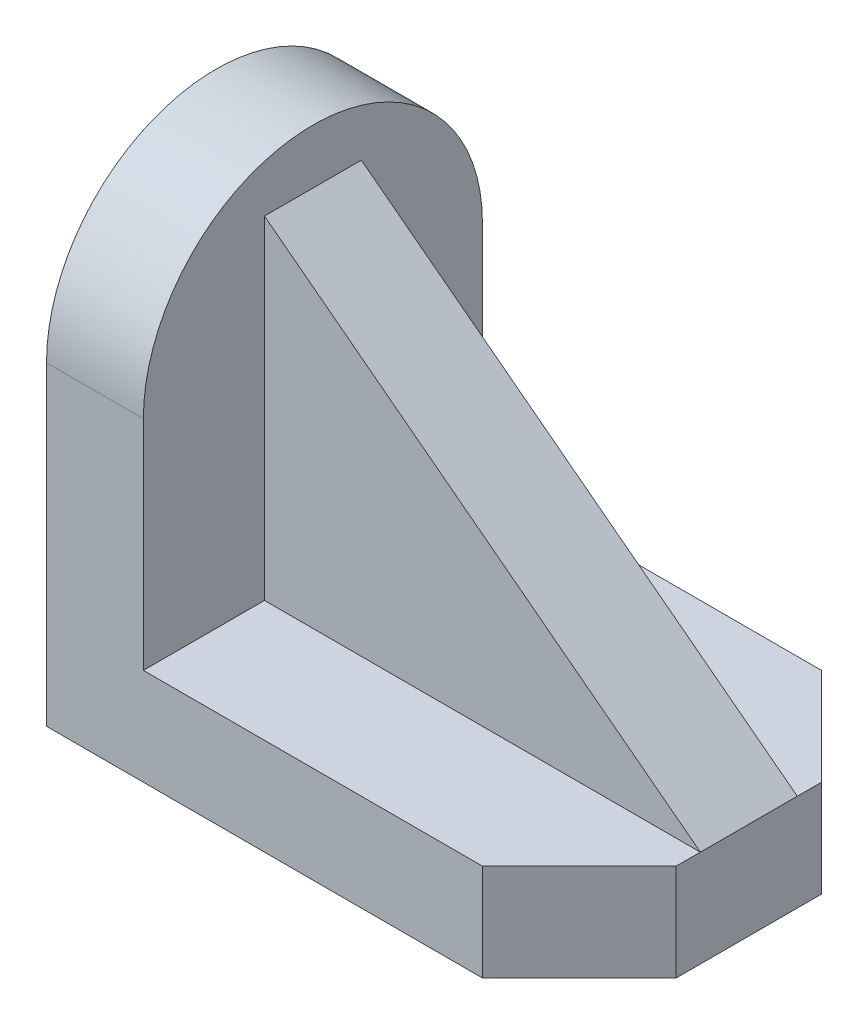
from build123d import *

# Parameters (mm, degrees)
SKETCH1_W           = 66
SKETCH1_H           = 42
BOSS_EXTRUDE1_DEPTH = 12
CHAMFER1_SIZE       = 12
CHAMFER2_SIZE       = 12
SKETCH2_W           = 54
SKETCH2_H           = 12
BOSS_EXTRUDE2_DEPTH = 42
CHAMFER3_SIZE       = 42
CHAMFER3_SIZE_2     = 55
SKETCH4_W           = 12
SKETCH4_H           = 42
BOSS_EXTRUDE3_DEPTH = 27
SKETCH7_W           = 12
SKETCH7_H           = 21
REVOLVE1_ANGLE      = 181


with BuildPart() as part:
    # Sketch1 → Boss-Extrude1 (new body)
    with BuildSketch(Plane(origin=(0, 0, 0), x_dir=(1, 0, 0), z_dir=(0, 1, 0))):
        Rectangle(SKETCH1_W, SKETCH1_H)
    extrude(amount=BOSS_EXTRUDE1_DEPTH)

    # Chamfer1
    chamfer1_edges = [part.edges().sort_by_distance(p)[0] for p in [
        (33, 6, 21),
    ]]
    chamfer(chamfer1_edges, length=CHAMFER1_SIZE)

    # Chamfer2
    chamfer2_edges = [part.edges().sort_by_distance(p)[0] for p in [
        (33, 6, -21),
    ]]
    chamfer(chamfer2_edges, length=CHAMFER2_SIZE)

    # Sketch2 → Boss-Extrude2 (add)
    with BuildSketch(Plane(origin=(0, 12, 0), x_dir=(1, 0, 0), z_dir=(0, 1, 0))):
        with Locations((6, 0)):
            Rectangle(SKETCH2_W, SKETCH2_H)
    extrude(amount=BOSS_EXTRUDE2_DEPTH)

    # Chamfer3
    # the kernel refuses this chamfer: 55, 42 mm, written as the material it takes off along each edge
    with BuildSketch(Plane(origin=(33, 54, 147.910486993), x_dir=(0.04031520079207804, -0.9991870118176548, 0), z_dir=(0, 0, -1))) as chamfer3_piece_1:
        Polygon((CHAMFER3_SIZE * 0.999187011818, CHAMFER3_SIZE * 0.0403152007921), (-CHAMFER3_SIZE_2 * 0.0403152007921, CHAMFER3_SIZE_2 * 0.999187011818), (0, 0), align=None)
    extrude(amount=295.820973986, mode=Mode.SUBTRACT)

    # Sketch4 → Boss-Extrude3 (add)
    with BuildSketch(Plane(origin=(0, 12, 0), x_dir=(1, 0, 0), z_dir=(0, 1, 0))):
        with Locations((-27, 0)):
            Rectangle(SKETCH4_W, SKETCH4_H)
    extrude(amount=BOSS_EXTRUDE3_DEPTH)

    # Sketch7 → Revolve1 (revolve)
    with BuildSketch(Plane(origin=(0, 39, 0), x_dir=(1, 0, 0), z_dir=(0, 1, 0))):
        with Locations((-27, 10.5)):
            Rectangle(SKETCH7_W, SKETCH7_H)
    revolve(axis=Axis((0, 39, 0), (1, 0, 0)), revolution_arc=REVOLVE1_ANGLE)


solid = part.part
